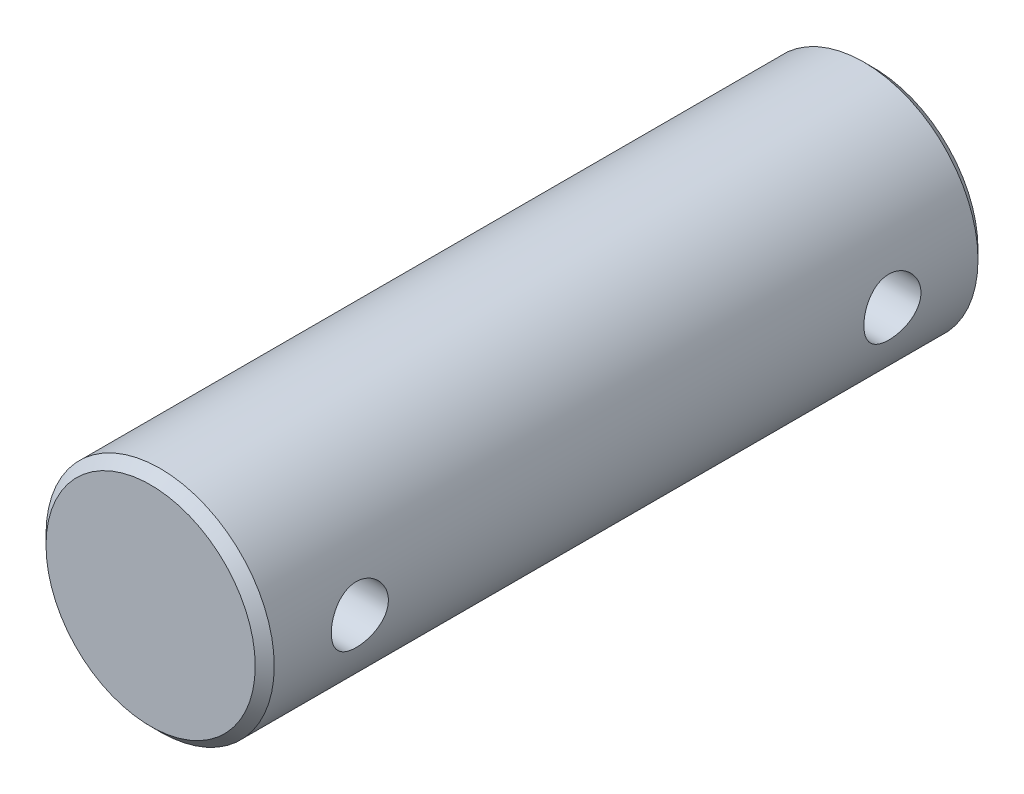
from build123d import *

# Parameters (mm, degrees)
SKETCH3_R               = 3
BOSS_EXTRUDE1_DEPTH     = 19
CUT_EXTRUDE1_DEPTH      = 20.467922334
CUT_EXTRUDE1_DEPTH_BACK = 20.467922334
SKETCH4_R               = 0.75
CHAMFER1_SIZE           = 0.25


with BuildPart() as part:
    # Sketch3 → Boss-Extrude1 (new body)
    with BuildSketch(Plane.XY):
        Circle(SKETCH3_R)
    extrude(amount=BOSS_EXTRUDE1_DEPTH)

    # Sketch4 → Cut-Extrude1 (cut, two sides: drawn at the far end of the back side and taken through both)
    with BuildSketch(Plane(origin=(0, 0, 0), x_dir=(0, 0, -1), z_dir=(1, 0, 0)).offset(-CUT_EXTRUDE1_DEPTH_BACK)):
        with Locations((-2.5, 0)):
            Circle(SKETCH4_R)
        with Locations((-16.5, 0)):
            Circle(SKETCH4_R)
    extrude(amount=CUT_EXTRUDE1_DEPTH + CUT_EXTRUDE1_DEPTH_BACK, mode=Mode.SUBTRACT)

    # Chamfer1
    chamfer1_edges = [part.edges().sort_by_distance(p)[0] for p in [
        (-3, 0, 0),
        (-3, 0, 19),
    ]]
    chamfer(chamfer1_edges, length=CHAMFER1_SIZE)


solid = part.part
